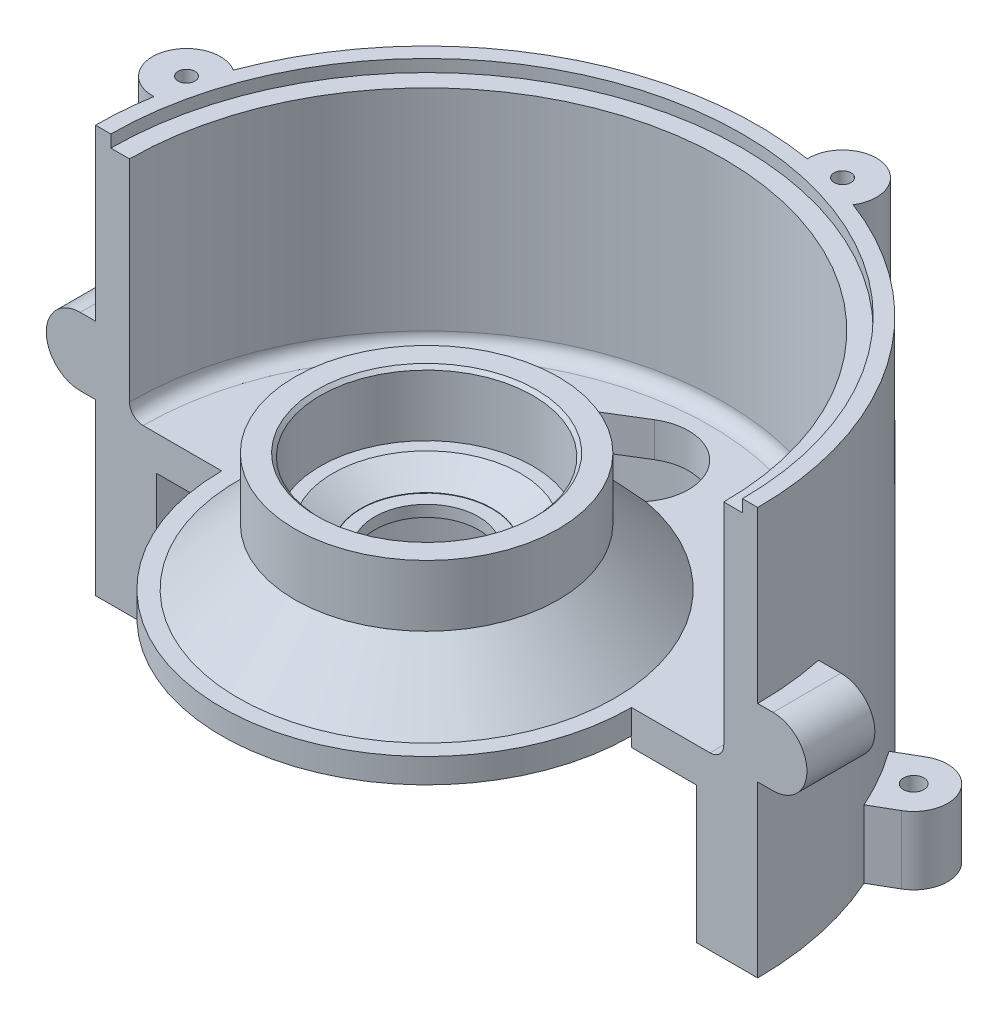
from build123d import *
from build123d.topology import SkipClean

# Parameters (mm, degrees)
REVOLU_O2_ANGLE                     = 180
ESBO_O4_R                           = 10
RESSALTO_EXTRUS_O1_DEPTH            = 35
RESSALTO_EXTRUS_O2_DEPTH            = 20
ESBO_O6_R                           = 2.5
CORTE_EXTRUS_O1_DEPTH               = 15
ESBO_O9_R                           = 1.25
CORTE_EXTRUS_O3_DEPTH               = 6
RESSALTO_EXTRUS_O6_DEPTH            = 20
RESSALTO_EXTRUS_O7_DEPTH            = 20
CORTE_EXTRUS_O6_START               = 10
ESBO_O16_R                          = 93
CORTE_EXTRUS_O6_DEPTH               = 10
PADR_OCIRCULAR1_COUNT               = 2
PADR_OCIRCULAR1_ANGLE               = 60
PADR_OCIRCULAR1_THE_OTHER_WAY_COUNT = 2
PADR_OCIRCULAR1_THE_OTHER_WAY_ANGLE = 60
ESBO_O46_R                          = 3
CORTE_EXTRUS_O14_DEPTH              = 30
CORTE_EXTRUS_O15_DEPTH              = 175.966168158
CORTE_EXTRUS_O15_DEPTH_BACK         = 175.966168158


with BuildPart() as part:
    # Esboço3 → Revolução2 (revolve)
    with BuildSketch(Plane.XY):
        with BuildLine():
            Line((97.5, 79.8), (97.5, 11.304491341))
            Line((97.5, 11.304491341), (97.5, 0))
            Line((97.5, 0), (97.5, -40.2))
            Line((97.5, -40.2), (79.5, -40.2))
            Line((79.5, -40.2), (79.5, 0))
            Line((79.5, 0), (60.342408243, 0))
            Line((60.342408243, 0), (60.239391973, 2.95))
            Line((60.239391973, 2.95), (52, 2.95))
            Line((52, 2.95), (44, 10.95))
            Line((44, 10.95), (31, 10.95))
            Line((31, 10.95), (31, 13.7))
            Line((31, 13.7), (22.6, 13.7))
            Line((22.6, 13.7), (22.6, 17))
            Line((22.6, 17), (19.3, 17))
            Line((19.3, 17), (19.3, 17.7))
            Line((19.3, 17.7), (15.3, 17.7))
            Line((15.3, 17.7), (15.3, 21.05))
            Line((15.3, 21.05), (19.3, 21.05))
            Line((19.3, 21.05), (19.3, 21.2))
            Line((19.3, 21.2), (27.626549127, 25.96))
            Line((27.626549127, 25.96), (31.3, 25.96))
            Line((31.3, 25.96), (31.3, 43.96))
            Line((31.3, 43.96), (32.3, 44.96))
            Line((32.3, 44.96), (38.8, 44.96))
            Line((38.8, 44.96), (38.8, 26.9))
            Line((38.8, 26.9), (55.5, 10.2))
            Line((55.5, 10.2), (83.5, 10.2))
            ThreePointArc((83.5, 10.2), (86.328427125, 11.371572875), (87.5, 14.2))
            Line((87.5, 14.2), (87.5, 76.2))
            Line((87.5, 76.2), (93, 76.2))
            Line((93, 76.2), (93, 79.8))
            Line((93, 79.8), (97.5, 79.8))
        make_face()
    revolve(axis=Axis((0, -3.322055656, 0), (0, 1, 0)), revolution_arc=REVOLU_O2_ANGLE)

    # Esboço20 → Revolução3 (revolve)
    with SkipClean():  # the faces are left unmerged after this step: merging them gives an invalid solid
        with BuildSketch(Plane.XY, mode=Mode.PRIVATE) as revolu_o3_sk:
            Polygon((60.342408243, 2.95), (60.342408243, 10.2), (55.5, 10.2), (38.8, 26.9), (38.8, 44.96), (32.3, 44.96), (31.3, 43.96), (31.3, 25.96), (27.626549127, 25.96), (19.3, 21.2), (19.3, 21.05), (15.3, 21.05), (15.3, 17.7), (19.3, 17.7), (19.3, 17), (22.6, 17), (22.6, 13.7), (31, 13.7), (31, 10.95), (44, 10.95), (52, 2.95), align=None)
        revolve(revolu_o3_sk.sketch.rotate(Axis((0, -3.322055656, 0), (0, 1, 0)), 90), axis=Axis((0, -3.322055656, 0), (0, 1, 0)))
    add(part.part.scale(1), mode=Mode.REPLACE)  # the faces are merged on a copy

    # Esboço4 → Ressalto-extrusão1 (add)
    with BuildSketch(Plane(origin=(0, 79.8, 0), x_dir=(1, 0, 0), z_dir=(0, 1, 0))):
        with Locations((25.881656302, 96.591656302)):
            Circle(ESBO_O4_R)
        with Locations((-96.591656302, 25.881656302)):
            Circle(ESBO_O4_R)
    extrude(amount=-RESSALTO_EXTRUS_O1_DEPTH)

    # Esboço5 → Ressalto-extrusão2 (add)
    with BuildSketch(Plane.XZ.offset(40.2)):
        with BuildLine():
            Line((10, -105), (10, -96.985823706))
            Line((10, -96.985823706), (-10, -96.985823706))
            Line((-10, -96.985823706), (-10, -105))
            ThreePointArc((-10, -105), (0, -115), (10, -105))
        make_face()
    ressalto_extrus_o2 = extrude(amount=-RESSALTO_EXTRUS_O2_DEPTH)

    # Esboço6 → Corte-extrusão1 (cut)
    with BuildSketch(Plane(origin=(0, 79.8, 0), x_dir=(1, 0, 0), z_dir=(0, 1, 0))):
        with Locations(Location((25.881656302, 96.591656302, 0), (0, 0, 270))):
            Circle(ESBO_O6_R)
        with Locations(Location((-96.591656302, 25.881656302, 0), (0, 0, 270))):
            Circle(ESBO_O6_R)
    extrude(amount=-CORTE_EXTRUS_O1_DEPTH, mode=Mode.SUBTRACT)

    # Esboço9 → Corte-extrusão3 (cut)
    with BuildSketch(Plane.XZ.offset(-13.7)):
        with Locations(Location((18.738329701, -18.738329701, 0), (0, 0, 270))):
            Circle(ESBO_O9_R)
        with Locations(Location((-18.738329701, -18.738329701, 0), (0, 0, 270))):
            Circle(ESBO_O9_R)
        with Locations(Location((-18.738329701, 18.738329701, 0), (0, 0, 270))):
            Circle(ESBO_O9_R)
        with Locations(Location((18.738329701, 18.738329701, 0), (0, 0, 270))):
            Circle(ESBO_O9_R)
    extrude(amount=-CORTE_EXTRUS_O3_DEPTH, mode=Mode.SUBTRACT)

    # Esboço12 → Ressalto-extrusão6 (add)
    with BuildSketch(Plane.XY):
        with BuildLine():
            Line((-102, 29.8), (-87.5, 29.8))
            Line((-87.5, 29.8), (-87.5, 9.8))
            Line((-87.5, 9.8), (-102, 9.8))
            ThreePointArc((-102, 9.8), (-112, 19.8), (-102, 29.8))
        make_face()
    extrude(amount=-RESSALTO_EXTRUS_O6_DEPTH)

    # Esboço13 → Ressalto-extrusão7 (add)
    with BuildSketch(Plane.XY):
        with BuildLine():
            Line((102, 29.8), (93.1, 29.8))
            Line((93.1, 29.8), (93.1, 9.8))
            Line((93.1, 9.8), (102, 9.8))
            ThreePointArc((102, 9.8), (112, 19.8), (102, 29.8))
        make_face()
    extrude(amount=-RESSALTO_EXTRUS_O7_DEPTH)

    # Esboço16 → Corte-extrusão6 (cut)
    with BuildSketch(Plane(origin=(0, 76.2, 0), x_dir=(1, 0, 0), z_dir=(0, 1, 0)).offset(CORTE_EXTRUS_O6_START)):
        Circle(ESBO_O16_R)
    extrude(amount=-CORTE_EXTRUS_O6_DEPTH, mode=Mode.SUBTRACT)

    # PadrãoCircular1: Ressalto-extrusão2 ×2 about axis
    padr_ocircular1_axis = Axis((0, 0, 0), (0, 1, 0))
    for i in range(1, PADR_OCIRCULAR1_COUNT):
        add(ressalto_extrus_o2.rotate(padr_ocircular1_axis, i * PADR_OCIRCULAR1_ANGLE / (PADR_OCIRCULAR1_COUNT - 1)))

    # PadrãoCircular1 the other way: Ressalto-extrusão2 ×2 about axis
    padr_ocircular1_the_other_way_axis = Axis((0, 0, 0), (0, -1, 0))
    for i in range(1, PADR_OCIRCULAR1_THE_OTHER_WAY_COUNT):
        add(ressalto_extrus_o2.rotate(padr_ocircular1_the_other_way_axis, i * PADR_OCIRCULAR1_THE_OTHER_WAY_ANGLE / (PADR_OCIRCULAR1_THE_OTHER_WAY_COUNT - 1)))

    # Esboço46 → Corte-extrusão14 (cut)
    with BuildSketch(Plane(origin=(0, -20.2, 0), x_dir=(1, 0, 0), z_dir=(0, 1, 0))):
        with Locations(Location((90.932667397, 52.5, 0), (0, 0, 270))):
            Circle(ESBO_O46_R)
        with Locations(Location((0, 105, 0), (0, 0, 270))):
            Circle(ESBO_O46_R)
        with Locations(Location((-90.932667397, 52.5, 0), (0, 0, 270))):
            Circle(ESBO_O46_R)
    extrude(amount=-CORTE_EXTRUS_O14_DEPTH, mode=Mode.SUBTRACT)

    # Esboço47 → Corte-extrusão15 (cut, two sides: drawn at the far end of the back side and taken through both)
    with SkipClean():  # the faces are left unmerged after this step: merging them gives an invalid solid
        with BuildSketch(Plane(origin=(0, 10.2, 0), x_dir=(1, 0, 0), z_dir=(0, 1, 0)).offset(-CORTE_EXTRUS_O15_DEPTH_BACK)):
            with BuildLine():
                Line((-60.827262138, 45.377960052), (-9.698115338, 76.775576961))
                ThreePointArc((-9.698115338, 76.775576961), (11.156996709, 71.489405367), (5.307399574, 50.785262738))
                Line((5.307399574, 50.785262738), (-45.821747226, 19.38764583))
                ThreePointArc((-45.821747226, 19.38764583), (-66.676859273, 24.673817424), (-60.827262138, 45.377960052))
            make_face()
        extrude(amount=CORTE_EXTRUS_O15_DEPTH + CORTE_EXTRUS_O15_DEPTH_BACK, mode=Mode.SUBTRACT)


solid = part.part
